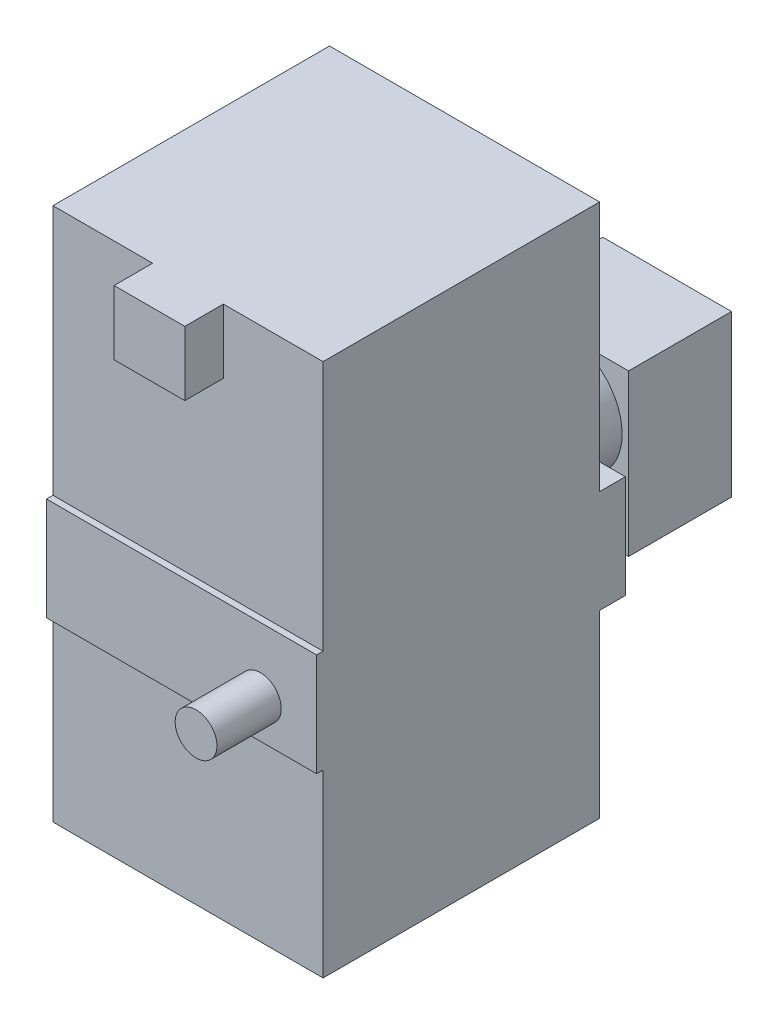
from build123d import *

# Parameters (mm, degrees)
SALIENTE_EXTRUIR1_DEPTH = 42
CROQUIS2_W              = 11
CROQUIS2_H              = 10
SALIENTE_EXTRUIR2_DEPTH = 6
CROQUIS3_R              = 3.25
SALIENTE_EXTRUIR3_DEPTH = 10
CROQUIS4_R              = 9
SALIENTE_EXTRUIR4_DEPTH = 16.5
CROQUIS5_W              = 20
CROQUIS5_H              = 25
SALIENTE_EXTRUIR5_DEPTH = 16
CROQUIS6_R              = 3.5
SALIENTE_EXTRUIR6_DEPTH = 1
REDONDEO2_R             = 4


with BuildPart() as part:
    # Croquis1 → Saliente-Extruir1 (new body)
    with BuildSketch(Plane(origin=(0, 0, 0), x_dir=(0, 0, -1), z_dir=(1, 0, 0))):
        Polygon((21.5, 2.5), (25.5, 2.5), (25.5, -13.5), (21.5, -13.5), (21.5, -41.5), (-21.5, -41.5), (-21.5, -13.5), (-22.5, -13.5), (-22.5, 2.5), (-21.5, 2.5), (-21.5, 41.5), (21.5, 41.5), align=None)
    extrude(amount=SALIENTE_EXTRUIR1_DEPTH)

    # Croquis2 → Saliente-Extruir2 (add)
    with BuildSketch(Plane.XY.offset(21.5)):
        with Locations((21, 36.5)):
            Rectangle(CROQUIS2_W, CROQUIS2_H)
    extrude(amount=SALIENTE_EXTRUIR2_DEPTH)

    # Croquis3 → Saliente-Extruir3 (add)
    with BuildSketch(Plane.XY.offset(22.5)):
        with Locations(Location((33.25, -7.5, 0), (0, 0, 180))):
            Circle(CROQUIS3_R)
    extrude(amount=SALIENTE_EXTRUIR3_DEPTH)

    # Croquis4 → Saliente-Extruir4 (add)
    with BuildSketch(Plane(origin=(0, 0, -25.5), x_dir=(-1, 0, 0), z_dir=(0, 0, -1))):
        with Locations(Location((-16, -8.5, 0), (0, 0, 213.748988596))):
            Circle(CROQUIS4_R)
    extrude(amount=SALIENTE_EXTRUIR4_DEPTH)

    # Croquis5 → Saliente-Extruir5 (add)
    with BuildSketch(Plane(origin=(0, 0, -42), x_dir=(-1, 0, 0), z_dir=(0, 0, -1))):
        with Locations((-16, -12)):
            Rectangle(CROQUIS5_W, CROQUIS5_H)
    extrude(amount=SALIENTE_EXTRUIR5_DEPTH)

    # Croquis6 → Saliente-Extruir6 (add)
    with BuildSketch(Plane(origin=(0, 0, -58), x_dir=(-1, 0, 0), z_dir=(0, 0, -1))):
        with Locations((-16, -8.5)):
            Circle(CROQUIS6_R)
    extrude(amount=SALIENTE_EXTRUIR6_DEPTH)

    # Redondeo2
    # the kernel refuses this fillet: 4 mm, written as the material it takes off along each edge
    with BuildSketch(Plane(origin=(16, -8.5, -59), x_dir=(-1, 0, 0), z_dir=(0, -1, 0))) as redondeo2_piece_1:
        with BuildLine():
            CenterArc((0.854248689, -4), REDONDEO2_R, 48.590377891, 41.409622109)
            Line((0.854248689, 0), (0.854248689, 0.08))
            Line((0.854248689, 0.08), (3.5, 0.08))
            Line((3.5, 0.08), (3.58, 0))
            ThreePointArc((3.58, 0), (3.58, -0.5), (3.552915026, -0.94))
            Line((3.552915026, -0.94), (3.5, -1))
        make_face()
    revolve(axis=Axis((16, -8.5, -59), (0, 0, -1)), mode=Mode.SUBTRACT)


solid = part.part
